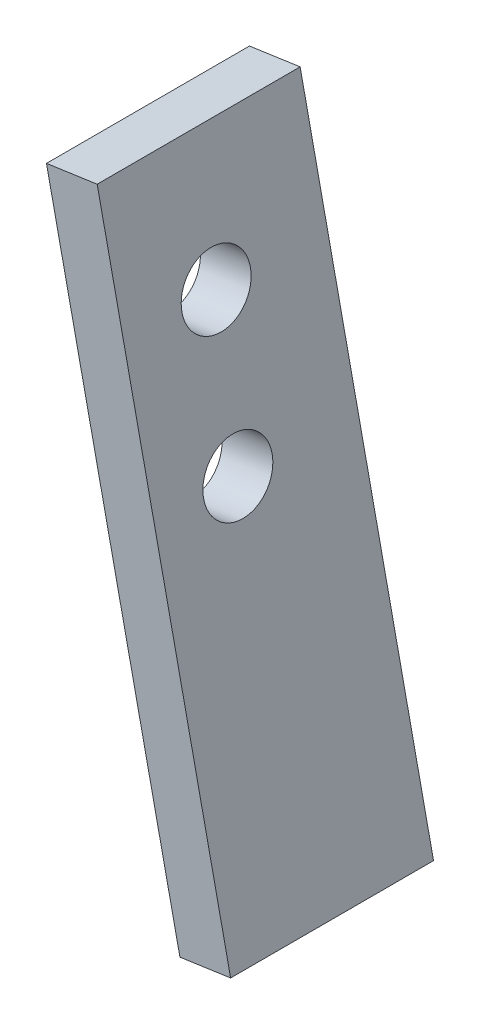
from build123d import *

# Parameters (mm, degrees)
SKETCH2_R           = 3.377890651
BOSS_EXTRUDE1_DEPTH = 5


with BuildPart() as part:
    # Sketch2 → Boss-Extrude1 (new body)
    with BuildSketch(Plane(origin=(-15.215309572, -2.572413543, 84.911881155), x_dir=(0, 0, 1), z_dir=(-0.9897749348145017, -0.1426379276803648, 0))):
        Polygon((0, 0), (-19.810711601, 0.012695688), (-23.557031025, -64.984916832), (-3.752176578, -64.997608766), align=None)
        with Locations((-9.757217826, -12.998342497)):
            Circle(SKETCH2_R, mode=Mode.SUBTRACT)
        with Locations((-9.757217826, -27.857099025)):
            Circle(SKETCH2_R, mode=Mode.SUBTRACT)
    extrude(amount=-BOSS_EXTRUDE1_DEPTH)


solid = part.part
